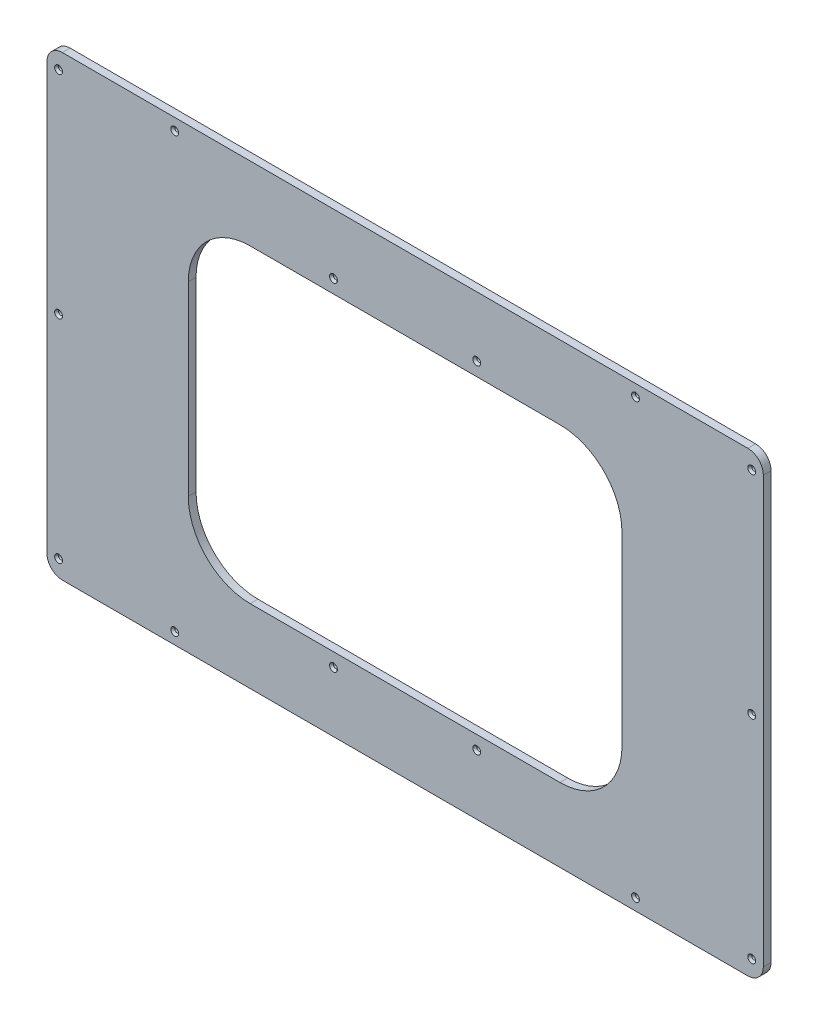
from build123d import *

# Parameters (mm, degrees)
SKETCH1_W                                        = 1174.75
SKETCH1_H                                        = 749.3
SKETCH1_W_2                                      = 711.2
SKETCH1_H_2                                      = 508
BOSS_EXTRUDE1_DEPTH                              = 12.7
FILLET1_R                                        = 101.6
CSK_FOR_1_4_FLAT_HEAD_MACHINE_SCREW1_D           = 6.7564
CSK_FOR_1_4_FLAT_HEAD_MACHINE_SCREW1_CSINK_D     = 12.8778
CSK_FOR_1_4_FLAT_HEAD_MACHINE_SCREW1_CSINK_ANGLE = 82
FILLET2_R                                        = 25.4


with BuildPart() as part:
    # Sketch1 → Boss-Extrude1 (new body)
    with BuildSketch(Plane.XY):
        Rectangle(SKETCH1_W, SKETCH1_H)
        Rectangle(SKETCH1_W_2, SKETCH1_H_2, mode=Mode.SUBTRACT)
    extrude(amount=BOSS_EXTRUDE1_DEPTH)

    # Fillet1
    fillet1_edges = [part.edges().sort_by_distance(p)[0] for p in [
        (355.6, 254, 6.35),
        (355.6, -254, 6.35),
        (-355.6, -254, 6.35),
        (-355.6, 254, 6.35),
    ]]
    fillet(fillet1_edges, radius=FILLET1_R)

    # CSK for 1/4 Flat Head Machine Screw1 (through all)
    with Locations(Plane.XY.offset(12.7)):
        with Locations((-568.325, -347.218), (-568.325, 0), (-377.825, 355.6), (-377.825, -355.6), (-568.325, 347.218), (377.825, -355.6), (568.325, -347.218), (568.325, 0), (568.325, 347.218), (377.825, 355.6), (-117.475, -276.225), (-117.475, 276.225), (117.475, 276.225), (117.475, -276.225)):
            CounterSinkHole(CSK_FOR_1_4_FLAT_HEAD_MACHINE_SCREW1_D / 2, CSK_FOR_1_4_FLAT_HEAD_MACHINE_SCREW1_CSINK_D / 2, counter_sink_angle=CSK_FOR_1_4_FLAT_HEAD_MACHINE_SCREW1_CSINK_ANGLE)

    # Fillet2
    fillet2_edges = [part.edges().sort_by_distance(p)[0] for p in [
        (587.375, 374.65, 6.35),
        (587.375, -374.65, 6.35),
        (-587.375, -374.65, 6.35),
        (-587.375, 374.65, 6.35),
    ]]
    fillet(fillet2_edges, radius=FILLET2_R)


solid = part.part
